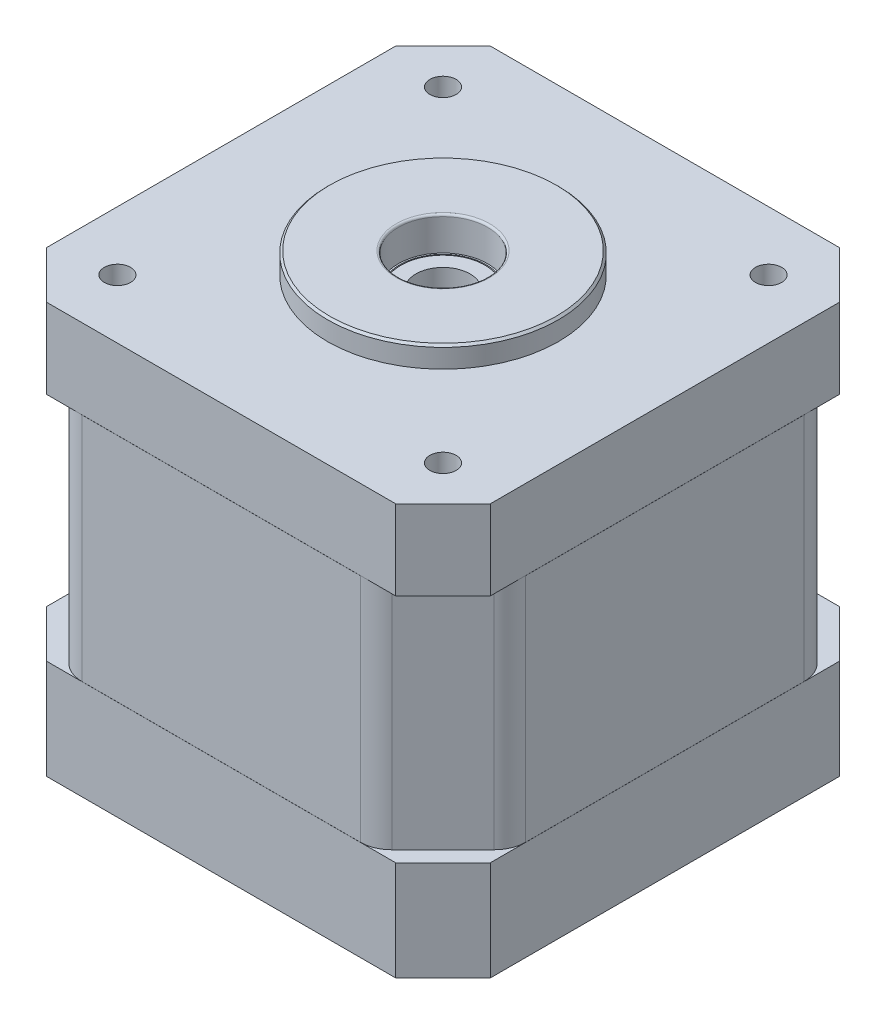
from build123d import *

# Parameters (mm, degrees)
CROQUIS1_R                      = 1
SALIENTE_EXTRUIR1_DEPTH         = 7.6
CROQUIS2_R                      = 11
SALIENTE_EXTRUIR2_DEPTH         = 2
CHAFL_N1_SIZE                   = 0.2
CROQUIS3_R                      = 4.25
CORTAR_EXTRUIR1_DEPTH           = 3.2
REDONDEO1_R                     = 0.2
CROQUIS4_R                      = 4.1
CROQUIS4_R_2                    = 4
CORTAR_EXTRUIR2_DEPTH           = 0.5
CROQUIS5_R                      = 2.5
SALIENTE_EXTRUIR3_DEPTH         = 21.2
CHAFL_N2_SIZE                   = 0.3
CORTAR_EXTRUIR4_START           = -17.2
CORTAR_EXTRUIR4_DEPTH           = 17.2
REDONDEO2_R                     = 0.1
CHAFL_N3_SIZE                   = 0.3
SALIENTE_EXTRUIR4_DEPTH         = 22
SALIENTE_EXTRUIR5_DEPTH         = 9.5
CROQUIS10_W                     = 16.35
CROQUIS10_H                     = 4
SALIENTE_EXTRUIR6_DEPTH         = 3.3
CORTAR_EXTRUIR5_START           = -0.5
CROQUIS11_R                     = 2.575
CROQUIS11_R_2                   = 2.5
CORTAR_EXTRUIR5_DEPTH           = 0.5
CROQUIS12_W                     = 14
CROQUIS12_H                     = 4.7
SALIENTE_EXTRUIR7_DEPTH         = 1
CROQUIS13_W                     = 15.2
CROQUIS13_H                     = 6.5
SALIENTE_EXTRUIR8_DEPTH         = 5.5
CORTAR_EXTRUIR6_DEPTH           = 4.1
CROQUIS15_W                     = 0.5
CROQUIS15_H                     = 0.5
SALIENTE_EXTRUIR9_DEPTH         = 3.5
CHAFL_N4_SIZE                   = 0.25
CROQUIS16_R                     = 3
CORTAR_EXTRUIR7_DEPTH           = 2.5
CROQUIS17_R                     = 2.75
SALIENTE_EXTRUIR10_DEPTH        = 2.3
REDONDEO3_R                     = 0.6
CORTAR_EXTRUIR8_DEPTH           = 1.1
CORTAR_EXTRUIR8_DRAFT           = -10
CORTAR_EXTRUIR8_PROFILE_2_DEPTH = 1.1
CORTAR_EXTRUIR8_PROFILE_2_DRAFT = -10
CORTAR_EXTRUIR8_PROFILE_3_DEPTH = 1.1
CORTAR_EXTRUIR8_PROFILE_3_DRAFT = -10
CORTAR_EXTRUIR8_PROFILE_4_DEPTH = 1.1
CORTAR_EXTRUIR8_PROFILE_4_DRAFT = -10
REDONDEO4_R                     = 0.2
CROQUIS19_R                     = 4.55
CORTAR_EXTRUIR9_DEPTH           = 3.7
CROQUIS20_R                     = 5.15
CORTAR_EXTRUIR10_DEPTH          = 2.5
REDONDEO5_R                     = 3
CORTAR_EXTRUIR_L_MINA1_DEPTH    = 0.01
CORTAR_EXTRUIR_L_MINA2_DEPTH    = 0.01
M3_TAPPED_HOLE1_D               = 2.5
M3_TAPPED_HOLE1_DEPTH           = 7.5
M3_TAPPED_HOLE1_TIP             = 0.751075774
CUT_EXTRUDE_START               = -30
SKETCH_1_R                      = 2.575
CUT_EXTRUDE_1_DEPTH             = 30


with BuildPart() as part:
    # Croquis1 → Saliente-Extruir1 (new body)
    with BuildSketch(Plane(origin=(0, 0, 0), x_dir=(1, 0, 0), z_dir=(0, 1, 0))):
        Polygon((-21.125, 16.625), (-16.625, 21.125), (16.625, 21.125), (21.125, 16.625), (21.125, -16.625), (16.625, -21.125), (-16.625, -21.125), (-21.125, -16.625), align=None)
        with Locations(Location((-15.5, 15.5, 0), (0, 0, 90))):
            Circle(CROQUIS1_R, mode=Mode.SUBTRACT)
        with Locations(Location((15.5, 15.5, 0), (0, 0, 90))):
            Circle(CROQUIS1_R, mode=Mode.SUBTRACT)
        with Locations(Location((-15.5, -15.5, 0), (0, 0, 90))):
            Circle(CROQUIS1_R, mode=Mode.SUBTRACT)
        with Locations(Location((15.5, -15.5, 0), (0, 0, 90))):
            Circle(CROQUIS1_R, mode=Mode.SUBTRACT)
    extrude(amount=SALIENTE_EXTRUIR1_DEPTH)

    # Croquis2 → Saliente-Extruir2 (add)
    with BuildSketch(Plane(origin=(0, 7.6, 0), x_dir=(1, 0, 0), z_dir=(0, 1, 0))):
        with Locations(Location((0, 0, 0), (0, 0, 90))):
            Circle(CROQUIS2_R)
    extrude(amount=SALIENTE_EXTRUIR2_DEPTH)

    # Chaflán1
    chafl_n1_edges = [part.edges().sort_by_distance(p)[0] for p in [
        (0, 9.6, 11),
    ]]
    chamfer(chafl_n1_edges, length=CHAFL_N1_SIZE)

    # Croquis3 → Cortar-Extruir1 (cut)
    with BuildSketch(Plane(origin=(0, 9.6, 0), x_dir=(1, 0, 0), z_dir=(0, 1, 0))):
        with Locations(Location((0, 0, 0), (0, 0, 270))):
            Circle(CROQUIS3_R)
    extrude(amount=-CORTAR_EXTRUIR1_DEPTH, mode=Mode.SUBTRACT)

    # Redondeo1
    redondeo1_edges = [part.edges().sort_by_distance(p)[0] for p in [
        (0, 9.6, -4.25),
    ]]
    fillet(redondeo1_edges, radius=REDONDEO1_R)

    # Croquis4 → Cortar-Extruir2 (cut)
    with BuildSketch(Plane(origin=(0, 6.4, 0), x_dir=(1, 0, 0), z_dir=(0, 1, 0))):
        with Locations(Location((0, 0, 0), (0, 0, 270))):
            Circle(CROQUIS4_R)
        with Locations(Location((0, 0, 0), (0, 0, 270))):
            Circle(CROQUIS4_R_2, mode=Mode.SUBTRACT)
    extrude(amount=-CORTAR_EXTRUIR2_DEPTH, mode=Mode.SUBTRACT)

    # Croquis5 → Saliente-Extruir3 (add)
    with BuildSketch(Plane(origin=(0, 6.4, 0), x_dir=(1, 0, 0), z_dir=(0, 1, 0))):
        with Locations(Location((0, 0, 0), (0, 0, 270))):
            Circle(CROQUIS5_R)
    extrude(amount=SALIENTE_EXTRUIR3_DEPTH)

    # Chaflán2
    chafl_n2_edges = [part.edges().sort_by_distance(p)[0] for p in [
        (0, 27.6, -2.5),
    ]]
    chamfer(chafl_n2_edges, length=CHAFL_N2_SIZE)

    # Croquis7 → Cortar-Extruir4 (cut)
    with BuildSketch(Plane(origin=(0, 27.6, 0), x_dir=(1, 0, 0), z_dir=(0, 1, 0)).offset(CORTAR_EXTRUIR4_START)):
        with BuildLine():
            Line((-1.5, 2), (1.5, 2))
            ThreePointArc((1.5, 2), (0, 2.5), (-1.5, 2))
        make_face()
    extrude(amount=CORTAR_EXTRUIR4_DEPTH, mode=Mode.SUBTRACT)

    # Redondeo2
    redondeo2_edges = [part.edges().sort_by_distance(p)[0] for p in [
        (0, 10.4, -2),
    ]]
    fillet(redondeo2_edges, radius=REDONDEO2_R)

    # Chaflán3
    chafl_n3_edges = [part.edges().sort_by_distance(p)[0] for p in [
        (0, 27.6, -2),
    ]]
    chamfer(chafl_n3_edges, length=CHAFL_N3_SIZE)

    # Croquis8 → Saliente-Extruir4 (add)
    with BuildSketch(Plane.XZ):
        Polygon((-14.5, 21.125), (14.5, 21.125), (21.125, 14.5), (21.125, -14.5), (14.5, -21.125), (-14.5, -21.125), (-21.125, -14.5), (-21.125, 14.5), align=None)
    extrude(amount=SALIENTE_EXTRUIR4_DEPTH)

    # Croquis9 → Saliente-Extruir5 (add)
    with BuildSketch(Plane.XZ.offset(22)):
        Polygon((16.625, 21.125), (-16.625, 21.125), (-21.125, 16.625), (-21.125, -16.625), (-16.625, -21.125), (16.625, -21.125), (21.125, -16.625), (21.125, 16.625), align=None)
    extrude(amount=SALIENTE_EXTRUIR5_DEPTH)

    # Croquis10 → Saliente-Extruir6 (add)
    with BuildSketch(Plane.XZ.offset(31.5)):
        with Locations((0, -23.125)):
            Rectangle(CROQUIS10_W, CROQUIS10_H)
    extrude(amount=-SALIENTE_EXTRUIR6_DEPTH)

    # Croquis11 → Cortar-Extruir5 (cut)
    with BuildSketch(Plane(origin=(0, 6.4, 0), x_dir=(1, 0, 0), z_dir=(0, 1, 0)).offset(CORTAR_EXTRUIR5_START)):
        with Locations(Location((0, 0, 0), (0, 0, 270))):
            Circle(CROQUIS11_R)
        with Locations(Location((0, 0, 0), (0, 0, 57.140119621))):
            Circle(CROQUIS11_R_2, mode=Mode.SUBTRACT)
    extrude(amount=CORTAR_EXTRUIR5_DEPTH, mode=Mode.SUBTRACT)

    # Croquis12 → Saliente-Extruir7 (add)
    with BuildSketch(Plane(origin=(0, -28.2, 0), x_dir=(1, 0, 0), z_dir=(0, 1, 0))):
        with Locations((0, 23.475)):
            Rectangle(CROQUIS12_W, CROQUIS12_H)
    extrude(amount=SALIENTE_EXTRUIR7_DEPTH)

    # Croquis13 → Saliente-Extruir8 (add)
    with BuildSketch(Plane(origin=(0, -27.2, 0), x_dir=(1, 0, 0), z_dir=(0, 1, 0))):
        with Locations((0, 24.375)):
            Rectangle(CROQUIS13_W, CROQUIS13_H)
    extrude(amount=SALIENTE_EXTRUIR8_DEPTH)

    # Croquis14 → Cortar-Extruir6 (cut)
    with BuildSketch(Plane(origin=(0, 0, -27.625), x_dir=(-1, 0, 0), z_dir=(0, 0, -1))):
        Polygon((4, -22.7), (4, -21.7), (-4, -21.7), (-4, -22.7), (-6.6, -22.7), (-6.6, -26.2), (6.6, -26.2), (6.6, -22.7), align=None)
    extrude(amount=-CORTAR_EXTRUIR6_DEPTH, mode=Mode.SUBTRACT)

    # Croquis15 → Saliente-Extruir9 (add)
    with BuildSketch(Plane(origin=(0, 0, -23.525), x_dir=(-1, 0, 0), z_dir=(0, 0, -1))):
        with Locations((-2.82428572, -24.45)):
            Rectangle(CROQUIS15_W, CROQUIS15_H)
        with Locations((-4.71428572, -24.45)):
            Rectangle(CROQUIS15_W, CROQUIS15_H)
        with Locations((-0.93428572, -24.45)):
            Rectangle(CROQUIS15_W, CROQUIS15_H)
        with Locations((0.95571428, -24.45)):
            Rectangle(CROQUIS15_W, CROQUIS15_H)
        with Locations((2.84571428, -24.45)):
            Rectangle(CROQUIS15_W, CROQUIS15_H)
        with Locations((4.73571428, -24.45)):
            Rectangle(CROQUIS15_W, CROQUIS15_H)
    extrude(amount=SALIENTE_EXTRUIR9_DEPTH)

    # Chaflán4
    chafl_n4_edges = [part.edges().sort_by_distance(p)[0] for p in [
        (4.46428572, -24.45, -27.025),
        (4.71428572, -24.2, -27.025),
        (4.96428572, -24.45, -27.025),
        (4.71428572, -24.7, -27.025),
        (2.57428572, -24.45, -27.025),
        (2.82428572, -24.2, -27.025),
        (3.07428572, -24.45, -27.025),
        (2.82428572, -24.7, -27.025),
        (0.68428572, -24.45, -27.025),
        (0.93428572, -24.2, -27.025),
        (1.18428572, -24.45, -27.025),
        (0.93428572, -24.7, -27.025),
        (-1.20571428, -24.45, -27.025),
        (-0.95571428, -24.2, -27.025),
        (-0.70571428, -24.45, -27.025),
        (-0.95571428, -24.7, -27.025),
        (-3.09571428, -24.45, -27.025),
        (-2.84571428, -24.2, -27.025),
        (-2.59571428, -24.45, -27.025),
        (-2.84571428, -24.7, -27.025),
        (-4.98571428, -24.45, -27.025),
        (-4.73571428, -24.2, -27.025),
        (-4.48571428, -24.45, -27.025),
        (-4.73571428, -24.7, -27.025),
    ]]
    chamfer(chafl_n4_edges, length=CHAFL_N4_SIZE - 0.0001)  # a hair under: the kernel refuses the full size

    # Croquis16 → Cortar-Extruir7 (cut)
    with BuildSketch(Plane.XZ.offset(31.5)):
        with Locations(Location((-15.5, 15.5, 0), (0, 0, 270))):
            Circle(CROQUIS16_R)
        with Locations(Location((15.5, 15.5, 0), (0, 0, 270))):
            Circle(CROQUIS16_R)
        with Locations(Location((-15.5, -15.5, 0), (0, 0, 270))):
            Circle(CROQUIS16_R)
        with Locations(Location((15.5, -15.5, 0), (0, 0, 270))):
            Circle(CROQUIS16_R)
    extrude(amount=-CORTAR_EXTRUIR7_DEPTH, mode=Mode.SUBTRACT)

    # Croquis17 → Saliente-Extruir10 (add)
    with BuildSketch(Plane.XZ.offset(29)):
        with Locations(Location((15.5, 15.5, 0), (0, 0, 270))):
            Circle(CROQUIS17_R)
        with Locations(Location((-15.5, 15.5, 0), (0, 0, 270))):
            Circle(CROQUIS17_R)
        with Locations(Location((15.5, -15.5, 0), (0, 0, 270))):
            Circle(CROQUIS17_R)
        with Locations(Location((-15.5, -15.5, 0), (0, 0, 270))):
            Circle(CROQUIS17_R)
    extrude(amount=SALIENTE_EXTRUIR10_DEPTH)

    # Redondeo3
    redondeo3_edges = [part.edges().sort_by_distance(p)[0] for p in [
        (15.5, -31.3, 18.25),
        (-15.5, -31.3, 18.25),
        (15.5, -31.3, -12.75),
        (-15.5, -31.3, -12.75),
    ]]
    fillet(redondeo3_edges, radius=REDONDEO3_R)


with BuildPart() as cortar_extruir8_tool:
    # Croquis18 → Cortar-Extruir8 (with draft: the straight prism first)
    with BuildSketch(Plane.XZ.offset(31.3)):
        Polygon((17.303122292, 14.545405845), (16.348528137, 15.5), (17.303122292, 16.454594155), (16.454594155, 17.303122292), (15.5, 16.348528137), (14.545405845, 17.303122292), (13.696877708, 16.454594155), (14.651471863, 15.5), (13.696877708, 14.545405845), (14.545405845, 13.696877708), (15.5, 14.651471863), (16.454594155, 13.696877708), align=None)
    extrude(amount=-CORTAR_EXTRUIR8_DEPTH)
    # Cortar-Extruir8: the draft: its side faces are tilted about the plane it starts from
    cortar_extruir8_sides = [cortar_extruir8_tool.faces().sort_by_distance(p)[0] for p in [
        (16.825825215, -30.75, 15.022702923),
        (16.825825215, -30.75, 15.977297077),
        (16.878858223, -30.75, 16.878858223),
        (15.977297077, -30.75, 16.825825215),
        (15.022702923, -30.75, 16.825825215),
        (14.121141777, -30.75, 16.878858223),
        (14.174174785, -30.75, 15.977297077),
        (14.174174785, -30.75, 15.022702923),
        (14.121141777, -30.75, 14.121141777),
        (15.022702923, -30.75, 14.174174785),
        (15.977297077, -30.75, 14.174174785),
        (16.878858223, -30.75, 14.121141777),
    ]]
    draft(cortar_extruir8_sides, Plane.XZ.offset(31.3), CORTAR_EXTRUIR8_DRAFT)


with BuildPart() as part_1:
    add(part.part)

    # Cortar-Extruir8: cut by cortar_extruir8_tool
    add(cortar_extruir8_tool.part, mode=Mode.SUBTRACT)


with BuildPart() as cortar_extruir8_profile_2_tool:
    # Croquis18 → Cortar-Extruir8 profile 2 (with draft: the straight prism first)
    with BuildSketch(Plane.XZ.offset(31.3)):
        Polygon((-17.303122292, 16.454594155), (-16.348528137, 15.5), (-17.303122292, 14.545405845), (-16.454594155, 13.696877708), (-15.5, 14.651471863), (-14.545405845, 13.696877708), (-13.696877708, 14.545405845), (-14.651471863, 15.5), (-13.696877708, 16.454594155), (-14.545405845, 17.303122292), (-15.5, 16.348528137), (-16.454594155, 17.303122292), align=None)
    extrude(amount=-CORTAR_EXTRUIR8_PROFILE_2_DEPTH)
    # Cortar-Extruir8 profile 2: the draft: its side faces are tilted about the plane it starts from
    cortar_extruir8_profile_2_sides = [cortar_extruir8_profile_2_tool.faces().sort_by_distance(p)[0] for p in [
        (-16.825825215, -30.75, 15.977297077),
        (-16.825825215, -30.75, 15.022702923),
        (-16.878858223, -30.75, 14.121141777),
        (-15.977297077, -30.75, 14.174174785),
        (-15.022702923, -30.75, 14.174174785),
        (-14.121141777, -30.75, 14.121141777),
        (-14.174174785, -30.75, 15.022702923),
        (-14.174174785, -30.75, 15.977297077),
        (-14.121141777, -30.75, 16.878858223),
        (-15.022702923, -30.75, 16.825825215),
        (-15.977297077, -30.75, 16.825825215),
        (-16.878858223, -30.75, 16.878858223),
    ]]
    draft(cortar_extruir8_profile_2_sides, Plane.XZ.offset(31.3), CORTAR_EXTRUIR8_PROFILE_2_DRAFT)


with BuildPart() as part_2:
    add(part_1.part)

    # Cortar-Extruir8 profile 2: cut by cortar_extruir8_profile_2_tool
    add(cortar_extruir8_profile_2_tool.part, mode=Mode.SUBTRACT)


with BuildPart() as cortar_extruir8_profile_3_tool:
    # Croquis18 → Cortar-Extruir8 profile 3 (with draft: the straight prism first)
    with BuildSketch(Plane.XZ.offset(31.3)):
        Polygon((-13.696877708, -16.454594155), (-14.651471863, -15.5), (-13.696877708, -14.545405845), (-14.545405845, -13.696877708), (-15.5, -14.651471863), (-16.454594155, -13.696877708), (-17.303122292, -14.545405845), (-16.348528137, -15.5), (-17.303122292, -16.454594155), (-16.454594155, -17.303122292), (-15.5, -16.348528137), (-14.545405845, -17.303122292), align=None)
    extrude(amount=-CORTAR_EXTRUIR8_PROFILE_3_DEPTH)
    # Cortar-Extruir8 profile 3: the draft: its side faces are tilted about the plane it starts from
    cortar_extruir8_profile_3_sides = [cortar_extruir8_profile_3_tool.faces().sort_by_distance(p)[0] for p in [
        (-14.174174785, -30.75, -15.977297077),
        (-14.174174785, -30.75, -15.022702923),
        (-14.121141777, -30.75, -14.121141777),
        (-15.022702923, -30.75, -14.174174785),
        (-15.977297077, -30.75, -14.174174785),
        (-16.878858223, -30.75, -14.121141777),
        (-16.825825215, -30.75, -15.022702923),
        (-16.825825215, -30.75, -15.977297077),
        (-16.878858223, -30.75, -16.878858223),
        (-15.977297077, -30.75, -16.825825215),
        (-15.022702923, -30.75, -16.825825215),
        (-14.121141777, -30.75, -16.878858223),
    ]]
    draft(cortar_extruir8_profile_3_sides, Plane.XZ.offset(31.3), CORTAR_EXTRUIR8_PROFILE_3_DRAFT)


with BuildPart() as part_3:
    add(part_2.part)

    # Cortar-Extruir8 profile 3: cut by cortar_extruir8_profile_3_tool
    add(cortar_extruir8_profile_3_tool.part, mode=Mode.SUBTRACT)


with BuildPart() as cortar_extruir8_profile_4_tool:
    # Croquis18 → Cortar-Extruir8 profile 4 (with draft: the straight prism first)
    with BuildSketch(Plane.XZ.offset(31.3)):
        Polygon((16.348528137, -15.5), (17.303122292, -14.545405845), (16.454594155, -13.696877708), (15.5, -14.651471863), (14.545405845, -13.696877708), (13.696877708, -14.545405845), (14.651471863, -15.5), (13.696877708, -16.454594155), (14.545405845, -17.303122292), (15.5, -16.348528137), (16.454594155, -17.303122292), (17.303122292, -16.454594155), align=None)
    extrude(amount=-CORTAR_EXTRUIR8_PROFILE_4_DEPTH)
    # Cortar-Extruir8 profile 4: the draft: its side faces are tilted about the plane it starts from
    cortar_extruir8_profile_4_sides = [cortar_extruir8_profile_4_tool.faces().sort_by_distance(p)[0] for p in [
        (16.825825215, -30.75, -15.022702923),
        (16.878858223, -30.75, -14.121141777),
        (15.977297077, -30.75, -14.174174785),
        (15.022702923, -30.75, -14.174174785),
        (14.121141777, -30.75, -14.121141777),
        (14.174174785, -30.75, -15.022702923),
        (14.174174785, -30.75, -15.977297077),
        (14.121141777, -30.75, -16.878858223),
        (15.022702923, -30.75, -16.825825215),
        (15.977297077, -30.75, -16.825825215),
        (16.878858223, -30.75, -16.878858223),
        (16.825825215, -30.75, -15.977297077),
    ]]
    draft(cortar_extruir8_profile_4_sides, Plane.XZ.offset(31.3), CORTAR_EXTRUIR8_PROFILE_4_DRAFT)


with BuildPart() as part_4:
    add(part_3.part)

    # Cortar-Extruir8 profile 4: cut by cortar_extruir8_profile_4_tool
    add(cortar_extruir8_profile_4_tool.part, mode=Mode.SUBTRACT)

    # Redondeo4
    redondeo4_edges = [part_4.edges().sort_by_distance(p)[0] for p in [
        (17.165972088, -30.75, 14.545405845),
        (16.454594155, -30.75, 13.834027912),
        (15.5, -30.75, 14.788622067),
        (14.545405845, -30.75, 13.834027912),
        (13.834027912, -30.75, 14.545405845),
        (14.788622067, -30.75, 15.5),
        (13.834027912, -30.75, 16.454594155),
        (14.545405845, -30.75, 17.165972088),
        (15.5, -30.75, 16.211377933),
        (16.454594155, -30.75, 17.165972088),
        (17.165972088, -30.75, 16.454594155),
        (16.211377933, -30.75, 15.5),
        (-14.788622067, -30.75, 15.5),
        (-13.834027912, -30.75, 14.545405845),
        (-14.545405845, -30.75, 13.834027912),
        (-15.5, -30.75, 14.788622067),
        (-16.454594155, -30.75, 13.834027912),
        (-17.165972088, -30.75, 14.545405845),
        (-16.211377933, -30.75, 15.5),
        (-17.165972088, -30.75, 16.454594155),
        (-16.454594155, -30.75, 17.165972088),
        (-15.5, -30.75, 16.211377933),
        (-14.545405845, -30.75, 17.165972088),
        (-13.834027912, -30.75, 16.454594155),
        (-13.834027912, -30.75, -16.454594155),
        (-14.545405845, -30.75, -17.165972088),
        (-15.5, -30.75, -16.211377933),
        (-16.454594155, -30.75, -17.165972088),
        (-17.165972088, -30.75, -16.454594155),
        (-16.211377933, -30.75, -15.5),
        (-17.165972088, -30.75, -14.545405845),
        (-16.454594155, -30.75, -13.834027912),
        (-15.5, -30.75, -14.788622067),
        (-14.545405845, -30.75, -13.834027912),
        (-13.834027912, -30.75, -14.545405845),
        (-14.788622067, -30.75, -15.5),
        (16.211377933, -30.75, -15.5),
        (17.165972088, -30.75, -16.454594155),
        (16.454594155, -30.75, -17.165972088),
        (15.5, -30.75, -16.211377933),
        (14.545405845, -30.75, -17.165972088),
        (13.834027912, -30.75, -16.454594155),
        (14.788622067, -30.75, -15.5),
        (13.834027912, -30.75, -14.545405845),
        (14.545405845, -30.75, -13.834027912),
        (15.5, -30.75, -14.788622067),
        (16.454594155, -30.75, -13.834027912),
        (17.165972088, -30.75, -14.545405845),
    ]]
    fillet(redondeo4_edges, radius=REDONDEO4_R)

    # Croquis19 → Cortar-Extruir9 (cut)
    with BuildSketch(Plane.XZ.offset(31.5)):
        with Locations(Location((0, 0, 0), (0, 0, 270))):
            Circle(CROQUIS19_R)
    extrude(amount=-CORTAR_EXTRUIR9_DEPTH, mode=Mode.SUBTRACT)

    # Croquis20 → Cortar-Extruir10 (cut)
    with BuildSketch(Plane.XZ.offset(27.8)):
        with Locations(Location((0, 0, 0), (0, 0, 270))):
            Circle(CROQUIS20_R)
    extrude(amount=CORTAR_EXTRUIR10_DEPTH, mode=Mode.SUBTRACT)

    # Redondeo5
    redondeo5_edges = [part_4.edges().sort_by_distance(p)[0] for p in [
        (-21.125, -11, -14.5),
        (-14.5, -11, -21.125),
        (-21.125, -11, 14.5),
        (-14.5, -11, 21.125),
        (14.5, -11, 21.125),
        (21.125, -11, 14.5),
        (14.5, -11, -21.125),
        (21.125, -11, -14.5),
    ]]
    fillet(redondeo5_edges, radius=REDONDEO5_R)

    # Croquis24 → Cortar-Extruir-Lámina1 (cut)
    with BuildSketch(Plane(origin=(0, -22, 0), x_dir=(1, 0, 0), z_dir=(0, 1, 0))):
        Polygon((-21.125, 14.5), (-21.125, -14.5), (-14.5, -21.125), (14.5, -21.125), (21.125, -14.5), (21.125, 14.5), (14.5, 21.125), (-14.5, 21.125), align=None)
        Polygon((-19.125, 13.671572875), (-19.125, -13.671572875), (-13.671572875, -19.125), (13.671572875, -19.125), (19.125, -13.671572875), (19.125, 13.671572875), (13.671572875, 19.125), (-13.671572875, 19.125), align=None, mode=Mode.SUBTRACT)
    extrude(amount=CORTAR_EXTRUIR_L_MINA1_DEPTH, mode=Mode.SUBTRACT)

    # Croquis25 → Cortar-Extruir-Lámina2 (cut)
    with BuildSketch(Plane.XZ):
        Polygon((21.125, -14.5), (21.125, 14.5), (14.5, 21.125), (-14.5, 21.125), (-21.125, 14.5), (-21.125, -14.5), (-14.5, -21.125), (14.5, -21.125), align=None)
        Polygon((19.125, -13.671572875), (19.125, 13.671572875), (13.671572875, 19.125), (-13.671572875, 19.125), (-19.125, 13.671572875), (-19.125, -13.671572875), (-13.671572875, -19.125), (13.671572875, -19.125), align=None, mode=Mode.SUBTRACT)
    extrude(amount=CORTAR_EXTRUIR_L_MINA2_DEPTH, mode=Mode.SUBTRACT)

    # M3 Tapped Hole1
    with Locations(Plane(origin=(0, 7.6, 0), x_dir=(1, 0, 0), z_dir=(0, 1, 0))):
        with Locations((-15.5, 15.5), (15.5, 15.5), (15.5, -15.5), (-15.5, -15.5)):
            Hole(M3_TAPPED_HOLE1_D / 2, depth=M3_TAPPED_HOLE1_DEPTH)
            with Locations((0, 0, -(M3_TAPPED_HOLE1_DEPTH + M3_TAPPED_HOLE1_TIP / 2))):  # 118° drill point
                Cone(0, M3_TAPPED_HOLE1_D / 2, M3_TAPPED_HOLE1_TIP, mode=Mode.SUBTRACT)

    # 草图1 → 切除-拉伸1 (cut)
    with BuildSketch(Plane(origin=(0, 27.6, 0), x_dir=(1, 0, 0), z_dir=(0, 1, 0)).offset(CUT_EXTRUDE_START)):
        with Locations(Location((0, 0, 0), (0, 0, 270))):
            Circle(SKETCH_1_R)
    extrude(amount=CUT_EXTRUDE_1_DEPTH, mode=Mode.SUBTRACT)


solid = part_4.part
